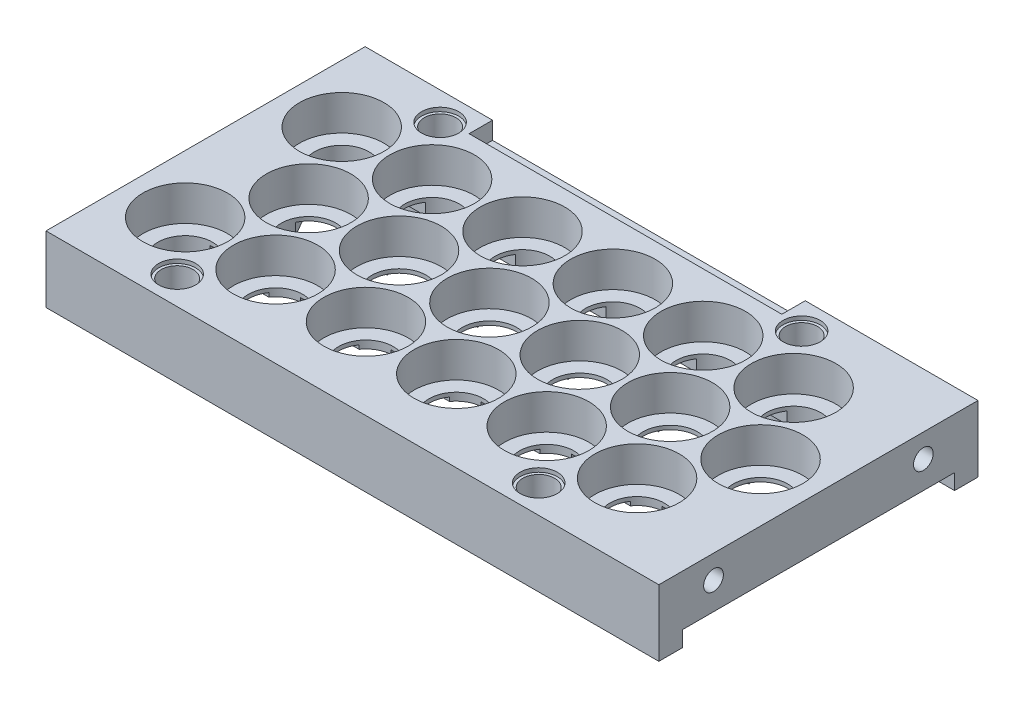
from build123d import *
from build123d.topology import SkipClean

# Parameters (mm, degrees)
SKETCH1_W            = 156.975
SKETCH1_H            = 81.746976195
SKETCH1_R            = 10.825
BOSS_EXTRUDE2_DEPTH  = 11
SKETCH1_3_R          = 10.825
SKETCH1_3_R_2        = 7
BOSS_EXTRUDE3_DEPTH  = 2
CUT_EXTRUDE1_DEPTH   = 1
CUT_EXTRUDE3_REACH   = 157.046
SKETCH9_R            = 4.0767
SKETCH10_R           = 4.7625
CUT_EXTRUDE4_DEPTH   = 1
SKETCH13_R           = 6.5
BOSS_EXTRUDE7_DEPTH  = 6
BOSS_EXTRUDE9_START  = 2
BOSS_EXTRUDE9_DEPTH  = 2
BOSS_EXTRUDE10_DEPTH = 2
SKETCH17_R           = 1.9431
CUT_EXTRUDE5_DEPTH   = 3.81
SKETCH18_W           = 80.1
SKETCH18_H           = 4.475
CUT_EXTRUDE6_DEPTH   = 6
SKETCH19_R           = 1.9431
CUT_EXTRUDE7_DEPTH   = 5
SKETCH20_R           = 2.5273
CUT_EXTRUDE8_DEPTH   = 10


with BuildPart() as part:
    # Sketch1 → Boss-Extrude2 (new body)
    with BuildSketch(Plane(origin=(0, 0, 0), x_dir=(1, 0, 0), z_dir=(0, 1, 0))):
        with Locations((63.6625, -20.048488098)):
            Rectangle(SKETCH1_W, SKETCH1_H)
        with Locations((0, -40.096976195)):
            Circle(SKETCH1_R, mode=Mode.SUBTRACT)
        with Locations((23.15, -40.096976195)):
            Circle(SKETCH1_R, mode=Mode.SUBTRACT)
        with Locations((46.3, -40.096976195)):
            Circle(SKETCH1_R, mode=Mode.SUBTRACT)
        with Locations((69.45, -40.096976195)):
            Circle(SKETCH1_R, mode=Mode.SUBTRACT)
        with Locations((92.6, -40.096976195)):
            Circle(SKETCH1_R, mode=Mode.SUBTRACT)
        with Locations((115.75, -40.096976195)):
            Circle(SKETCH1_R, mode=Mode.SUBTRACT)
        with Locations((11.575, -20.048488098)):
            Circle(SKETCH1_R, mode=Mode.SUBTRACT)
        Circle(SKETCH1_R, mode=Mode.SUBTRACT)
        with Locations((23.15, 0)):
            Circle(SKETCH1_R, mode=Mode.SUBTRACT)
        with Locations((34.725, -20.048488098)):
            Circle(SKETCH1_R, mode=Mode.SUBTRACT)
        with Locations((57.875, -20.048488098)):
            Circle(SKETCH1_R, mode=Mode.SUBTRACT)
        with Locations((46.3, 0)):
            Circle(SKETCH1_R, mode=Mode.SUBTRACT)
        with Locations((81.025, -20.048488098)):
            Circle(SKETCH1_R, mode=Mode.SUBTRACT)
        with Locations((69.45, 0)):
            Circle(SKETCH1_R, mode=Mode.SUBTRACT)
        with Locations((92.6, 0)):
            Circle(SKETCH1_R, mode=Mode.SUBTRACT)
        with Locations((104.175, -20.048488098)):
            Circle(SKETCH1_R, mode=Mode.SUBTRACT)
        with Locations((127.325, -20.048488098)):
            Circle(SKETCH1_R, mode=Mode.SUBTRACT)
        with Locations((115.75, 0)):
            Circle(SKETCH1_R, mode=Mode.SUBTRACT)
    extrude(amount=BOSS_EXTRUDE2_DEPTH)

    # Sketch1<3> → Boss-Extrude3 (add)
    # profile 1 of 18: a face of its own
    with BuildSketch(Plane(origin=(0, 0, 0), x_dir=(1, 0, 0), z_dir=(0, 1, 0))):
        Circle(SKETCH1_3_R)
        Circle(SKETCH1_3_R_2, mode=Mode.SUBTRACT)
    # profile 2 of 18: a face of its own
    with BuildSketch(Plane(origin=(0, 0, 0), x_dir=(1, 0, 0), z_dir=(0, 1, 0))):
        with Locations((11.575, -20.048488098)):
            Circle(SKETCH1_3_R)
        with Locations((11.575, -20.048488098)):
            Circle(SKETCH1_3_R_2, mode=Mode.SUBTRACT)
    # profile 3 of 18: a face of its own
    with BuildSketch(Plane(origin=(0, 0, 0), x_dir=(1, 0, 0), z_dir=(0, 1, 0))):
        with Locations((0, -40.096976195)):
            Circle(SKETCH1_3_R)
        with Locations((0, -40.096976195)):
            Circle(SKETCH1_3_R_2, mode=Mode.SUBTRACT)
    # profile 4 of 18: a face of its own
    with BuildSketch(Plane(origin=(0, 0, 0), x_dir=(1, 0, 0), z_dir=(0, 1, 0))):
        with Locations((23.15, 0)):
            Circle(SKETCH1_3_R)
        with Locations((23.15, 0)):
            Circle(SKETCH1_3_R_2, mode=Mode.SUBTRACT)
    # profile 5 of 18: a face of its own
    with BuildSketch(Plane(origin=(0, 0, 0), x_dir=(1, 0, 0), z_dir=(0, 1, 0))):
        with Locations((34.725, -20.048488098)):
            Circle(SKETCH1_3_R)
        with Locations((34.725, -20.048488098)):
            Circle(SKETCH1_3_R_2, mode=Mode.SUBTRACT)
    # profile 6 of 18: a face of its own
    with BuildSketch(Plane(origin=(0, 0, 0), x_dir=(1, 0, 0), z_dir=(0, 1, 0))):
        with Locations((23.15, -40.096976195)):
            Circle(SKETCH1_3_R)
        with Locations((23.15, -40.096976195)):
            Circle(SKETCH1_3_R_2, mode=Mode.SUBTRACT)
    # profile 7 of 18: a face of its own
    with BuildSketch(Plane(origin=(0, 0, 0), x_dir=(1, 0, 0), z_dir=(0, 1, 0))):
        with Locations((46.3, 0)):
            Circle(SKETCH1_3_R)
        with Locations((46.3, 0)):
            Circle(SKETCH1_3_R_2, mode=Mode.SUBTRACT)
    # profile 8 of 18: a face of its own
    with BuildSketch(Plane(origin=(0, 0, 0), x_dir=(1, 0, 0), z_dir=(0, 1, 0))):
        with Locations((57.875, -20.048488098)):
            Circle(SKETCH1_3_R)
        with Locations((57.875, -20.048488098)):
            Circle(SKETCH1_3_R_2, mode=Mode.SUBTRACT)
    # profile 9 of 18: a face of its own
    with BuildSketch(Plane(origin=(0, 0, 0), x_dir=(1, 0, 0), z_dir=(0, 1, 0))):
        with Locations((46.3, -40.096976195)):
            Circle(SKETCH1_3_R)
        with Locations((46.3, -40.096976195)):
            Circle(SKETCH1_3_R_2, mode=Mode.SUBTRACT)
    # profile 10 of 18: a face of its own
    with BuildSketch(Plane(origin=(0, 0, 0), x_dir=(1, 0, 0), z_dir=(0, 1, 0))):
        with Locations((69.45, 0)):
            Circle(SKETCH1_3_R)
        with Locations((69.45, 0)):
            Circle(SKETCH1_3_R_2, mode=Mode.SUBTRACT)
    # profile 11 of 18: a face of its own
    with BuildSketch(Plane(origin=(0, 0, 0), x_dir=(1, 0, 0), z_dir=(0, 1, 0))):
        with Locations((81.025, -20.048488098)):
            Circle(SKETCH1_3_R)
        with Locations((81.025, -20.048488098)):
            Circle(SKETCH1_3_R_2, mode=Mode.SUBTRACT)
    # profile 12 of 18: a face of its own
    with BuildSketch(Plane(origin=(0, 0, 0), x_dir=(1, 0, 0), z_dir=(0, 1, 0))):
        with Locations((69.45, -40.096976195)):
            Circle(SKETCH1_3_R)
        with Locations((69.45, -40.096976195)):
            Circle(SKETCH1_3_R_2, mode=Mode.SUBTRACT)
    # profile 13 of 18: a face of its own
    with BuildSketch(Plane(origin=(0, 0, 0), x_dir=(1, 0, 0), z_dir=(0, 1, 0))):
        with Locations((92.6, 0)):
            Circle(SKETCH1_3_R)
        with Locations((92.6, 0)):
            Circle(SKETCH1_3_R_2, mode=Mode.SUBTRACT)
    # profile 14 of 18: a face of its own
    with BuildSketch(Plane(origin=(0, 0, 0), x_dir=(1, 0, 0), z_dir=(0, 1, 0))):
        with Locations((104.175, -20.048488098)):
            Circle(SKETCH1_3_R)
        with Locations((104.175, -20.048488098)):
            Circle(SKETCH1_3_R_2, mode=Mode.SUBTRACT)
    # profile 15 of 18: a face of its own
    with BuildSketch(Plane(origin=(0, 0, 0), x_dir=(1, 0, 0), z_dir=(0, 1, 0))):
        with Locations((92.6, -40.096976195)):
            Circle(SKETCH1_3_R)
        with Locations((92.6, -40.096976195)):
            Circle(SKETCH1_3_R_2, mode=Mode.SUBTRACT)
    # profile 16 of 18: a face of its own
    with BuildSketch(Plane(origin=(0, 0, 0), x_dir=(1, 0, 0), z_dir=(0, 1, 0))):
        with Locations((115.75, 0)):
            Circle(SKETCH1_3_R)
        with Locations((115.75, 0)):
            Circle(SKETCH1_3_R_2, mode=Mode.SUBTRACT)
    # profile 17 of 18: a face of its own
    with BuildSketch(Plane(origin=(0, 0, 0), x_dir=(1, 0, 0), z_dir=(0, 1, 0))):
        with Locations((127.325, -20.048488098)):
            Circle(SKETCH1_3_R)
        with Locations((127.325, -20.048488098)):
            Circle(SKETCH1_3_R_2, mode=Mode.SUBTRACT)
    # profile 18 of 18: a face of its own
    with BuildSketch(Plane(origin=(0, 0, 0), x_dir=(1, 0, 0), z_dir=(0, 1, 0))):
        with Locations((115.75, -40.096976195)):
            Circle(SKETCH1_3_R)
        with Locations((115.75, -40.096976195)):
            Circle(SKETCH1_3_R_2, mode=Mode.SUBTRACT)
    extrude(amount=BOSS_EXTRUDE3_DEPTH)

    # Sketch2 → Cut-Extrude1 (cut)
    with BuildSketch(Plane.XZ):
        with BuildLine():
            Line((-0.591820292, 33.12203901), (5.238617062, 23.023425283))
            ThreePointArc((5.238617062, 23.023425283), (8.075, 26.110665924), (12.166820292, 27.023425283))
            Line((12.166820292, 27.023425283), (6.92820323, 36.096976195))
            Line((6.92820323, 36.096976195), (17.405437353, 36.096976195))
            ThreePointArc((17.405437353, 36.096976195), (16.15, 40.096976195), (17.405437353, 44.096976195))
            Line((17.405437353, 44.096976195), (5.744562647, 44.096976195))
            ThreePointArc((5.744562647, 44.096976195), (6.062177826, 36.596976195), (-0.591820292, 33.12203901))
        make_face()
        with BuildLine():
            Line((27.79679677, 24.048488098), (17.319562647, 24.048488098))
            ThreePointArc((17.319562647, 24.048488098), (18.575, 20.048488098), (17.319562647, 16.048488098))
            Line((17.319562647, 16.048488098), (27.79679677, 16.048488098))
            Line((27.79679677, 16.048488098), (22.558179708, 6.974937186))
            ThreePointArc((22.558179708, 6.974937186), (26.124937186, 6.336382938), (28.894562647, 4))
            Line((28.894562647, 4), (6.92820323, 4))
            Line((6.92820323, 4), (12.166820292, 13.073550912))
            ThreePointArc((12.166820292, 13.073550912), (8.075, 13.986310271), (5.238617062, 17.073550912))
            Line((5.238617062, 17.073550912), (-0.591820292, 6.974937186))
            ThreePointArc((-0.591820292, 6.974937186), (2.974937186, 6.336382938), (5.744562647, 4))
            Line((5.744562647, 4), (0, 4))
            ThreePointArc((0, 4), (-4, 0), (0, -4))
            Line((0, -4), (115.75, -4))
            ThreePointArc((115.75, -4), (119.75, 0), (115.75, 4))
            Line((115.75, 4), (99.52820323, 4))
            Line((99.52820323, 4), (104.766820292, 13.073550912))
            ThreePointArc((104.766820292, 13.073550912), (97.175, 20.048488098), (104.766820292, 27.023425283))
            Line((104.766820292, 27.023425283), (99.52820323, 36.096976195))
            Line((99.52820323, 36.096976195), (110.005437353, 36.096976195))
            ThreePointArc((110.005437353, 36.096976195), (108.75, 40.096976195), (110.005437353, 44.096976195))
            Line((110.005437353, 44.096976195), (98.344562647, 44.096976195))
            ThreePointArc((98.344562647, 44.096976195), (98.662177826, 36.596976195), (92.008179708, 33.12203901))
            Line((92.008179708, 33.12203901), (97.24679677, 24.048488098))
            Line((97.24679677, 24.048488098), (86.769562647, 24.048488098))
            ThreePointArc((86.769562647, 24.048488098), (88.025, 20.048488098), (86.769562647, 16.048488098))
            Line((86.769562647, 16.048488098), (97.24679677, 16.048488098))
            Line((97.24679677, 16.048488098), (92.008179708, 6.974937186))
            ThreePointArc((92.008179708, 6.974937186), (95.574937186, 6.336382938), (98.344562647, 4))
            Line((98.344562647, 4), (76.37820323, 4))
            Line((76.37820323, 4), (81.616820292, 13.073550912))
            ThreePointArc((81.616820292, 13.073550912), (74.025, 20.048488098), (81.616820292, 27.023425283))
            Line((81.616820292, 27.023425283), (76.37820323, 36.096976195))
            Line((76.37820323, 36.096976195), (86.855437353, 36.096976195))
            ThreePointArc((86.855437353, 36.096976195), (85.6, 40.096976195), (86.855437353, 44.096976195))
            Line((86.855437353, 44.096976195), (75.194562647, 44.096976195))
            ThreePointArc((75.194562647, 44.096976195), (75.512177826, 36.596976195), (68.858179708, 33.12203901))
            Line((68.858179708, 33.12203901), (74.09679677, 24.048488098))
            Line((74.09679677, 24.048488098), (63.619562647, 24.048488098))
            ThreePointArc((63.619562647, 24.048488098), (64.875, 20.048488098), (63.619562647, 16.048488098))
            Line((63.619562647, 16.048488098), (74.09679677, 16.048488098))
            Line((74.09679677, 16.048488098), (68.858179708, 6.974937186))
            ThreePointArc((68.858179708, 6.974937186), (72.424937186, 6.336382938), (75.194562647, 4))
            Line((75.194562647, 4), (53.22820323, 4))
            Line((53.22820323, 4), (58.466820292, 13.073550912))
            ThreePointArc((58.466820292, 13.073550912), (50.875, 20.048488098), (58.466820292, 27.023425283))
            Line((58.466820292, 27.023425283), (53.22820323, 36.096976195))
            Line((53.22820323, 36.096976195), (63.705437353, 36.096976195))
            ThreePointArc((63.705437353, 36.096976195), (62.45, 40.096976195), (63.705437353, 44.096976195))
            Line((63.705437353, 44.096976195), (52.044562647, 44.096976195))
            ThreePointArc((52.044562647, 44.096976195), (52.362177826, 36.596976195), (45.708179708, 33.12203901))
            Line((45.708179708, 33.12203901), (50.94679677, 24.048488098))
            Line((50.94679677, 24.048488098), (40.469562647, 24.048488098))
            ThreePointArc((40.469562647, 24.048488098), (41.725, 20.048488098), (40.469562647, 16.048488098))
            Line((40.469562647, 16.048488098), (50.94679677, 16.048488098))
            Line((50.94679677, 16.048488098), (45.708179708, 6.974937186))
            ThreePointArc((45.708179708, 6.974937186), (49.274937186, 6.336382938), (52.044562647, 4))
            Line((52.044562647, 4), (30.07820323, 4))
            Line((30.07820323, 4), (35.316820292, 13.073550912))
            ThreePointArc((35.316820292, 13.073550912), (27.725, 20.048488098), (35.316820292, 27.023425283))
            Line((35.316820292, 27.023425283), (30.07820323, 36.096976195))
            Line((30.07820323, 36.096976195), (40.555437353, 36.096976195))
            ThreePointArc((40.555437353, 36.096976195), (39.3, 40.096976195), (40.555437353, 44.096976195))
            Line((40.555437353, 44.096976195), (28.894562647, 44.096976195))
            ThreePointArc((28.894562647, 44.096976195), (29.212177826, 36.596976195), (22.558179708, 33.12203901))
            Line((22.558179708, 33.12203901), (27.79679677, 24.048488098))
        make_face()
        with BuildLine():
            Line((127.916820292, 27.023425283), (122.086382938, 37.12203901))
            ThreePointArc((122.086382938, 37.12203901), (119.25, 34.034798369), (115.158179708, 33.12203901))
            Line((115.158179708, 33.12203901), (120.39679677, 24.048488098))
            Line((120.39679677, 24.048488098), (109.919562647, 24.048488098))
            ThreePointArc((109.919562647, 24.048488098), (111.175, 20.048488098), (109.919562647, 16.048488098))
            Line((109.919562647, 16.048488098), (120.39679677, 16.048488098))
            Line((120.39679677, 16.048488098), (115.158179708, 6.974937186))
            ThreePointArc((115.158179708, 6.974937186), (119.25, 6.062177826), (122.086382938, 2.974937186))
            Line((122.086382938, 2.974937186), (127.916820292, 13.073550912))
            ThreePointArc((127.916820292, 13.073550912), (120.325, 20.048488098), (127.916820292, 27.023425283))
        make_face()
    extrude(amount=-CUT_EXTRUDE1_DEPTH, mode=Mode.SUBTRACT)

    # Sketch9 → Cut-Extrude3 (cut, up to next)
    with BuildSketch(Plane(origin=(0, 11, 0), x_dir=(1, 0, 0), z_dir=(0, 1, 0)), mode=Mode.PRIVATE) as cut_extrude3_sk1:
        with Locations((11.575, 13.625)):
            Circle(SKETCH9_R)
    cut_extrude3_tool1 = extrude(cut_extrude3_sk1.sketch, amount=-CUT_EXTRUDE3_REACH, mode=Mode.PRIVATE) & part.part
    # Sketch9 → Cut-Extrude3 (cut, up to next)
    with BuildSketch(Plane(origin=(0, 11, 0), x_dir=(1, 0, 0), z_dir=(0, 1, 0)), mode=Mode.PRIVATE) as cut_extrude3_sk2:
        with Locations((11.575, -53.721976195)):
            Circle(SKETCH9_R)
    cut_extrude3_tool2 = extrude(cut_extrude3_sk2.sketch, amount=-CUT_EXTRUDE3_REACH, mode=Mode.PRIVATE) & part.part
    # Sketch9 → Cut-Extrude3 (cut, up to next)
    with BuildSketch(Plane(origin=(0, 11, 0), x_dir=(1, 0, 0), z_dir=(0, 1, 0)), mode=Mode.PRIVATE) as cut_extrude3_sk3:
        with Locations((104.175, -53.721976195)):
            Circle(SKETCH9_R)
    cut_extrude3_tool3 = extrude(cut_extrude3_sk3.sketch, amount=-CUT_EXTRUDE3_REACH, mode=Mode.PRIVATE) & part.part
    # Sketch9 → Cut-Extrude3 (cut, up to next)
    with BuildSketch(Plane(origin=(0, 11, 0), x_dir=(1, 0, 0), z_dir=(0, 1, 0)), mode=Mode.PRIVATE) as cut_extrude3_sk4:
        with Locations((104.175, 13.625)):
            Circle(SKETCH9_R)
    cut_extrude3_tool4 = extrude(cut_extrude3_sk4.sketch, amount=-CUT_EXTRUDE3_REACH, mode=Mode.PRIVATE) & part.part
    add(cut_extrude3_tool1.solids().sort_by_distance((11.575, 11, -13.625))[0], mode=Mode.SUBTRACT)
    add(cut_extrude3_tool2.solids().sort_by_distance((11.575, 11, 53.721976))[0], mode=Mode.SUBTRACT)
    add(cut_extrude3_tool3.solids().sort_by_distance((104.175, 11, 53.721976))[0], mode=Mode.SUBTRACT)
    add(cut_extrude3_tool4.solids().sort_by_distance((104.175, 11, -13.625))[0], mode=Mode.SUBTRACT)

    # Sketch10 → Cut-Extrude4 (cut)
    with BuildSketch(Plane(origin=(0, 11, 0), x_dir=(1, 0, 0), z_dir=(0, 1, 0))):
        with Locations((11.575, 13.625)):
            Circle(SKETCH10_R)
        with Locations((104.175, 13.625)):
            Circle(SKETCH10_R)
        with Locations((104.175, -53.721976195)):
            Circle(SKETCH10_R)
        with Locations((11.575, -53.721976195)):
            Circle(SKETCH10_R)
    extrude(amount=-CUT_EXTRUDE4_DEPTH, mode=Mode.SUBTRACT)

    # Sketch13 → Boss-Extrude7 (add)
    # profile 1 of 2: a face of its own
    with BuildSketch(Plane.XZ):
        with BuildLine():
            ThreePointArc((3.665512027, 54.921976195), (11.575, 45.721976195), (19.484487973, 54.921976195))
            Line((19.484487973, 54.921976195), (96.265512027, 54.921976195))
            ThreePointArc((96.265512027, 54.921976195), (104.175, 45.721976195), (112.084487973, 54.921976195))
            Line((112.084487973, 54.921976195), (142.15, 54.921976195))
            Line((142.15, 54.921976195), (142.15, 60.921976195))
            Line((142.15, 60.921976195), (-14.825, 60.921976195))
            Line((-14.825, 60.921976195), (-14.825, 54.921976195))
            Line((-14.825, 54.921976195), (3.665512027, 54.921976195))
        make_face()
        with Locations((11.575, 53.721976195)):
            Circle(SKETCH13_R, mode=Mode.SUBTRACT)
        with Locations((104.175, 53.721976195)):
            Circle(SKETCH13_R, mode=Mode.SUBTRACT)
    # profile 2 of 2: a face of its own
    with BuildSketch(Plane.XZ):
        with BuildLine():
            Line((-14.825, -14.825), (-14.825, -20.825))
            Line((-14.825, -20.825), (142.15, -20.825))
            Line((142.15, -20.825), (142.15, -14.825))
            Line((142.15, -14.825), (112.084487973, -14.825))
            ThreePointArc((112.084487973, -14.825), (104.175, -5.625), (96.265512027, -14.825))
            Line((96.265512027, -14.825), (19.484487973, -14.825))
            ThreePointArc((19.484487973, -14.825), (11.575, -5.625), (3.665512027, -14.825))
            Line((3.665512027, -14.825), (-14.825, -14.825))
        make_face()
        with Locations((11.575, -13.625)):
            Circle(SKETCH13_R, mode=Mode.SUBTRACT)
        with Locations((104.175, -13.625)):
            Circle(SKETCH13_R, mode=Mode.SUBTRACT)
    extrude(amount=BOSS_EXTRUDE7_DEPTH)

    # Sketch14 → Boss-Extrude9 (add)
    with SkipClean():  # the faces are left unmerged after this step: merging them gives an invalid solid
        with BuildSketch(Plane.XZ.offset(BOSS_EXTRUDE9_START)):
            with BuildLine():
                Line((142.15, 54.921976195), (142.15, -14.825))
                Line((142.15, -14.825), (112.084487973, -14.825))
                ThreePointArc((112.084487973, -14.825), (104.175, -5.625), (96.265512027, -14.825))
                Line((96.265512027, -14.825), (19.484487973, -14.825))
                ThreePointArc((19.484487973, -14.825), (11.575, -5.625), (3.665512027, -14.825))
                Line((3.665512027, -14.825), (-14.825, -14.825))
                Line((-14.825, -14.825), (-14.825, 54.921976195))
                Line((-14.825, 54.921976195), (3.665512027, 54.921976195))
                ThreePointArc((3.665512027, 54.921976195), (11.575, 45.721976195), (19.484487973, 54.921976195))
                Line((19.484487973, 54.921976195), (96.265512027, 54.921976195))
                ThreePointArc((96.265512027, 54.921976195), (104.175, 45.721976195), (112.084487973, 54.921976195))
                Line((112.084487973, 54.921976195), (142.15, 54.921976195))
            make_face()
            with BuildLine():
                Line((5.238617062, 17.073550912), (-0.591820292, 6.974937186))
                ThreePointArc((-0.591820292, 6.974937186), (-6.062177826, -3.5), (5.744562647, -4))
                Line((5.744562647, -4), (17.405437353, -4))
                ThreePointArc((17.405437353, -4), (23.15, -7), (28.894562647, -4))
                Line((28.894562647, -4), (40.555437353, -4))
                ThreePointArc((40.555437353, -4), (46.3, -7), (52.044562647, -4))
                Line((52.044562647, -4), (63.705437353, -4))
                ThreePointArc((63.705437353, -4), (69.45, -7), (75.194562647, -4))
                Line((75.194562647, -4), (86.855437353, -4))
                ThreePointArc((86.855437353, -4), (92.6, -7), (98.344562647, -4))
                Line((98.344562647, -4), (110.005437353, -4))
                ThreePointArc((110.005437353, -4), (119.25, -6.062177826), (122.086382938, 2.974937186))
                Line((122.086382938, 2.974937186), (127.916820292, 13.073550912))
                ThreePointArc((127.916820292, 13.073550912), (134.325, 20.048488098), (127.916820292, 27.023425283))
                Line((127.916820292, 27.023425283), (122.086382938, 37.12203901))
                ThreePointArc((122.086382938, 37.12203901), (119.25, 46.159154022), (110.005437353, 44.096976195))
                Line((110.005437353, 44.096976195), (98.344562647, 44.096976195))
                ThreePointArc((98.344562647, 44.096976195), (92.6, 47.096976195), (86.855437353, 44.096976195))
                Line((86.855437353, 44.096976195), (75.194562647, 44.096976195))
                ThreePointArc((75.194562647, 44.096976195), (69.45, 47.096976195), (63.705437353, 44.096976195))
                Line((63.705437353, 44.096976195), (52.044562647, 44.096976195))
                ThreePointArc((52.044562647, 44.096976195), (46.3, 47.096976195), (40.555437353, 44.096976195))
                Line((40.555437353, 44.096976195), (28.894562647, 44.096976195))
                ThreePointArc((28.894562647, 44.096976195), (23.15, 47.096976195), (17.405437353, 44.096976195))
                Line((17.405437353, 44.096976195), (5.744562647, 44.096976195))
                ThreePointArc((5.744562647, 44.096976195), (-6.062177826, 43.596976195), (-0.591820292, 33.12203901))
                Line((-0.591820292, 33.12203901), (5.238617062, 23.023425283))
                ThreePointArc((5.238617062, 23.023425283), (4.575, 20.048488098), (5.238617062, 17.073550912))
            make_face(mode=Mode.SUBTRACT)
        extrude(amount=-BOSS_EXTRUDE9_DEPTH)

    # Sketch16 → Boss-Extrude10 (add)
    with SkipClean():  # the faces are left unmerged after this step: merging them gives an invalid solid
        with BuildSketch(Plane.XZ):
            with BuildLine():
                Line((15.536128823, 32.859238845), (20.688871177, 29.884301659))
                ThreePointArc((20.688871177, 29.884301659), (21.237909283, 27.835263554), (19.188871177, 27.286225448))
                Line((19.188871177, 27.286225448), (14.036128823, 30.261162634))
                ThreePointArc((14.036128823, 30.261162634), (13.487090717, 32.310200739), (15.536128823, 32.859238845))
            make_face()
            with BuildLine():
                Line((38.686128823, 32.859238845), (43.838871177, 29.884301659))
                ThreePointArc((43.838871177, 29.884301659), (44.387909283, 27.835263554), (42.338871177, 27.286225448))
                Line((42.338871177, 27.286225448), (37.186128823, 30.261162634))
                ThreePointArc((37.186128823, 30.261162634), (36.637090717, 32.310200739), (38.686128823, 32.859238845))
            make_face()
            with BuildLine():
                Line((61.836128823, 32.859238845), (66.988871177, 29.884301659))
                ThreePointArc((66.988871177, 29.884301659), (67.537909283, 27.835263554), (65.488871177, 27.286225448))
                Line((65.488871177, 27.286225448), (60.336128823, 30.261162634))
                ThreePointArc((60.336128823, 30.261162634), (59.787090717, 32.310200739), (61.836128823, 32.859238845))
            make_face()
            with BuildLine():
                Line((84.986128823, 32.859238845), (90.138871177, 29.884301659))
                ThreePointArc((90.138871177, 29.884301659), (90.687909283, 27.835263554), (88.638871177, 27.286225448))
                Line((88.638871177, 27.286225448), (83.486128823, 30.261162634))
                ThreePointArc((83.486128823, 30.261162634), (82.937090717, 32.310200739), (84.986128823, 32.859238845))
            make_face()
            with BuildLine():
                Line((108.136128823, 32.859238845), (113.288871177, 29.884301659))
                ThreePointArc((113.288871177, 29.884301659), (113.837909283, 27.835263554), (111.788871177, 27.286225448))
                Line((111.788871177, 27.286225448), (106.636128823, 30.261162634))
                ThreePointArc((106.636128823, 30.261162634), (106.087090717, 32.310200739), (108.136128823, 32.859238845))
            make_face()
            with BuildLine():
                Line((15.536128823, 7.23773735), (20.688871177, 10.212674536))
                ThreePointArc((20.688871177, 10.212674536), (21.237909283, 12.261712642), (19.188871177, 12.810750747))
                Line((19.188871177, 12.810750747), (14.036128823, 9.835813562))
                ThreePointArc((14.036128823, 9.835813562), (13.487090717, 7.786775456), (15.536128823, 7.23773735))
            make_face()
            with BuildLine():
                Line((38.686128823, 7.23773735), (43.838871177, 10.212674536))
                ThreePointArc((43.838871177, 10.212674536), (44.387909283, 12.261712642), (42.338871177, 12.810750747))
                Line((42.338871177, 12.810750747), (37.186128823, 9.835813562))
                ThreePointArc((37.186128823, 9.835813562), (36.637090717, 7.786775456), (38.686128823, 7.23773735))
            make_face()
            with BuildLine():
                Line((61.836128823, 7.23773735), (66.988871177, 10.212674536))
                ThreePointArc((66.988871177, 10.212674536), (67.537909283, 12.261712642), (65.488871177, 12.810750747))
                Line((65.488871177, 12.810750747), (60.336128823, 9.835813562))
                ThreePointArc((60.336128823, 9.835813562), (59.787090717, 7.786775456), (61.836128823, 7.23773735))
            make_face()
            with BuildLine():
                Line((84.986128823, 7.23773735), (90.138871177, 10.212674536))
                ThreePointArc((90.138871177, 10.212674536), (90.687909283, 12.261712642), (88.638871177, 12.810750747))
                Line((88.638871177, 12.810750747), (83.486128823, 9.835813562))
                ThreePointArc((83.486128823, 9.835813562), (82.937090717, 7.786775456), (84.986128823, 7.23773735))
            make_face()
            with BuildLine():
                Line((108.136128823, 7.23773735), (113.288871177, 10.212674536))
                ThreePointArc((113.288871177, 10.212674536), (113.837909283, 12.261712642), (111.788871177, 12.810750747))
                Line((111.788871177, 12.810750747), (106.636128823, 9.835813562))
                ThreePointArc((106.636128823, 9.835813562), (106.087090717, 7.786775456), (108.136128823, 7.23773735))
            make_face()
        extrude(amount=BOSS_EXTRUDE10_DEPTH)

    # Sketch17 → Cut-Extrude5 (cut)
    with BuildSketch(Plane(origin=(0, -2, 0), x_dir=(-1, 0, 0), z_dir=(0, -1, 0))):
        with Locations((10.825, -49.509476195)):
            Circle(SKETCH17_R)
        with Locations((-57.875, -49.509476195)):
            Circle(SKETCH17_R)
        with Locations((-132.15, -49.509476195)):
            Circle(SKETCH17_R)
        with Locations((-132.15, 9.4125)):
            Circle(SKETCH17_R)
        with Locations((-57.875, 9.4125)):
            Circle(SKETCH17_R)
        with Locations((10.825, 9.4125)):
            Circle(SKETCH17_R)
    extrude(amount=-CUT_EXTRUDE5_DEPTH, mode=Mode.SUBTRACT)

    # Sketch18 → Cut-Extrude6 (cut)
    with BuildSketch(Plane(origin=(0, 0, -20.825), x_dir=(-1, 0, 0), z_dir=(0, 0, -1))):
        with Locations((-57.85, 8.7625)):
            Rectangle(SKETCH18_W, SKETCH18_H)
    extrude(amount=-CUT_EXTRUDE6_DEPTH, mode=Mode.SUBTRACT)

    # Sketch19 → Cut-Extrude7 (cut)
    with BuildSketch(Plane(origin=(0, 0, -20.825), x_dir=(-1, 0, 0), z_dir=(0, 0, -1))):
        with Locations((-85.9, 0.2625)):
            Circle(SKETCH19_R)
        with Locations((-29.8, 0.2625)):
            Circle(SKETCH19_R)
    extrude(amount=-CUT_EXTRUDE7_DEPTH, mode=Mode.SUBTRACT)

    # Sketch20 → Cut-Extrude8 (cut)
    with BuildSketch(Plane(origin=(142.15, 0, 0), x_dir=(0, 0, -1), z_dir=(1, 0, 0))):
        with Locations((-46.921976195, 5)):
            Circle(SKETCH20_R)
        with Locations((6.825, 5)):
            Circle(SKETCH20_R)
    extrude(amount=-CUT_EXTRUDE8_DEPTH, mode=Mode.SUBTRACT)


solid = part.part
